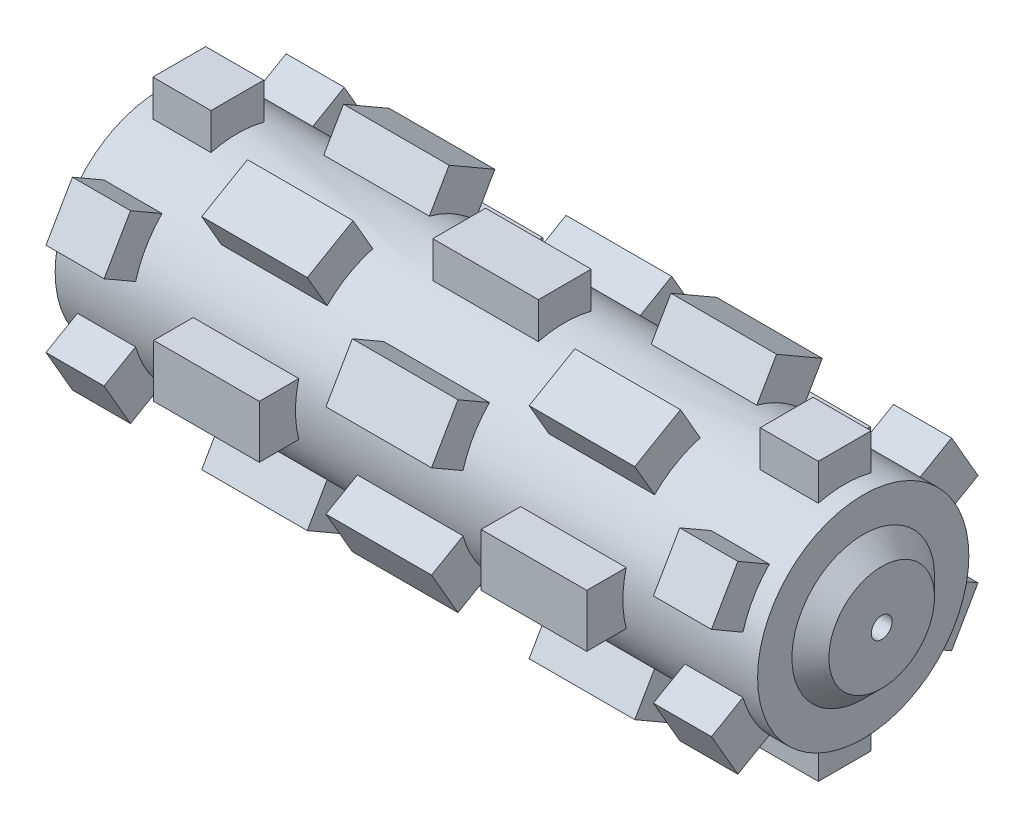
from build123d import *
from build123d.topology import SkipClean

# Parameters (mm, degrees)
SKETCH1_R            = 50.8
SKETCH1_W            = 25.4
SKETCH1_H            = 31.75
BOSS_EXTRUDE3_DEPTH  = 50.8
SKETCH2_R            = 50.8
BOSS_EXTRUDE4_DEPTH  = 27.94
SKETCH3_R            = 50.8
BOSS_EXTRUDE5_DEPTH  = 50.8
SKETCH4_R            = 50.8
BOSS_EXTRUDE6_DEPTH  = 27.94
SKETCH5_R            = 50.8
SKETCH5_W            = 25.4
SKETCH5_H            = 31.75
BOSS_EXTRUDE7_DEPTH  = 27.94
BOSS_EXTRUDE8_START  = 27.94
SKETCH6_R            = 50.8
BOSS_EXTRUDE8_DEPTH  = 27.94
BOSS_EXTRUDE9_START  = 50.8
SKETCH7_R            = 50.8
SKETCH7_W            = 31.75
SKETCH7_H            = 25.4
BOSS_EXTRUDE9_DEPTH  = 50.8
BOSS_EXTRUDE10_START = 27.94
SKETCH8_R            = 50.8
BOSS_EXTRUDE10_DEPTH = 27.94
BOSS_EXTRUDE11_START = 27.94
SKETCH9_R            = 50.8
SKETCH9_W            = 25.4
SKETCH9_H            = 31.75
BOSS_EXTRUDE11_DEPTH = 27.94
SKETCH10_R           = 50.8
BOSS_EXTRUDE12_DEPTH = 8.89
BOSS_EXTRUDE13_START = 8.89
SKETCH11_R           = 50.8
BOSS_EXTRUDE13_DEPTH = 8.89
SKETCH12_R           = 25.4
BOSS_EXTRUDE14_DEPTH = 8.89
BOSS_EXTRUDE15_START = 8.89
SKETCH13_R           = 25.4
BOSS_EXTRUDE15_DEPTH = 8.89
SKETCH14_R           = 5
CUT_EXTRUDE1_DEPTH   = 369.166294367
CHAMFER3_SIZE        = 8.89


with BuildPart() as part:
    # Sketch1 → Boss-Extrude3 (new body)
    with BuildSketch(Plane(origin=(0, 0, 0), x_dir=(0, 0, -1), z_dir=(1, 0, 0))):
        Circle(SKETCH1_R)
        with Locations((0, 50.8)):
            Rectangle(SKETCH1_W, SKETCH1_H)
        Polygon((51.392243797, 44.336022628), (23.895937227, 28.461022628), (36.595937227, 6.463977372), (64.092243797, 22.338977372), align=None)
        Polygon((64.092243797, -22.338977372), (36.595937227, -6.463977372), (23.895937227, -28.461022628), (51.392243797, -44.336022628), align=None)
        with Locations((0, -50.8)):
            Rectangle(SKETCH1_W, SKETCH1_H)
        Polygon((-51.392243797, -44.336022628), (-23.895937227, -28.461022628), (-36.595937227, -6.463977372), (-64.092243797, -22.338977372), align=None)
        Polygon((-64.092243797, 22.338977372), (-36.595937227, 6.463977372), (-23.895937227, 28.461022628), (-51.392243797, 44.336022628), align=None)
    extrude(amount=BOSS_EXTRUDE3_DEPTH)

    # Sketch2 → Boss-Extrude4 (add)
    with BuildSketch(Plane(origin=(50.8, 0, 0), x_dir=(0, 0, -1), z_dir=(1, 0, 0))):
        with Locations(Location((0, 0, 0), (0, 0, 164.477512186))):
            Circle(SKETCH2_R)
    extrude(amount=BOSS_EXTRUDE4_DEPTH)

    # Sketch3 → Boss-Extrude5 (add)
    with BuildSketch(Plane(origin=(78.74, 0, 0), x_dir=(0, 0, -1), z_dir=(1, 0, 0))):
        with Locations(Location((0, 0, 0), (0, 0, 165.522487814))):
            Circle(SKETCH3_R)
        Polygon((36.437276545, 12.7), (36.437276545, 0), (36.437276545, -12.7), (68.187276545, -12.7), (68.187276545, 12.7), align=None)
        Polygon((18.218638272, 31.555607132), (29.2171609, 25.205607132), (45.0921609, 52.701913703), (23.095115644, 65.401913703), (7.220115644, 37.905607132), align=None)
        Polygon((29.2171609, -25.205607132), (18.218638272, -31.555607132), (7.220115644, -37.905607132), (23.095115644, -65.401913703), (45.0921609, -52.701913703), align=None)
        Polygon((-7.220115644, -37.905607132), (-18.218638272, -31.555607132), (-29.2171609, -25.205607132), (-45.0921609, -52.701913703), (-23.095115644, -65.401913703), align=None)
        Polygon((-36.437276545, -12.7), (-36.437276545, 0), (-36.437276545, 12.7), (-68.187276545, 12.7), (-68.187276545, -12.7), align=None)
        Polygon((-29.2171609, 25.205607132), (-18.218638272, 31.555607132), (-7.220115644, 37.905607132), (-23.095115644, 65.401913703), (-45.0921609, 52.701913703), align=None)
    extrude(amount=BOSS_EXTRUDE5_DEPTH)

    # Sketch4 → Boss-Extrude6 (add)
    with BuildSketch(Plane(origin=(129.54, 0, 0), x_dir=(0, 0, -1), z_dir=(1, 0, 0))):
        with Locations(Location((0, 0, 0), (0, 0, 164.477512186))):
            Circle(SKETCH4_R)
    extrude(amount=BOSS_EXTRUDE6_DEPTH)

    # Sketch5 → Boss-Extrude7 (add)
    with BuildSketch(Plane(origin=(157.48, 0, 0), x_dir=(0, 0, -1), z_dir=(1, 0, 0))):
        with Locations(Location((0, 0, 0), (0, 0, 164.477512186))):
            Circle(SKETCH5_R)
        with Locations((0, 50.8)):
            Rectangle(SKETCH5_W, SKETCH5_H)
        Polygon((51.392243797, 44.336022628), (23.895937227, 28.461022628), (36.595937227, 6.463977372), (64.092243797, 22.338977372), align=None)
        Polygon((64.092243797, -22.338977372), (36.595937227, -6.463977372), (23.895937227, -28.461022628), (51.392243797, -44.336022628), align=None)
        with Locations((0, -50.8)):
            Rectangle(SKETCH5_W, SKETCH5_H)
        Polygon((-51.392243797, -44.336022628), (-23.895937227, -28.461022628), (-36.595937227, -6.463977372), (-64.092243797, -22.338977372), align=None)
        Polygon((-64.092243797, 22.338977372), (-36.595937227, 6.463977372), (-23.895937227, 28.461022628), (-51.392243797, 44.336022628), align=None)
    extrude(amount=BOSS_EXTRUDE7_DEPTH)

    # Sketch6 → Boss-Extrude8 (add)
    with SkipClean():  # the faces are left unmerged after this step: merging them gives an invalid solid
        with BuildSketch(Plane.ZY.offset(BOSS_EXTRUDE8_START)):
            Circle(SKETCH6_R)
        extrude(amount=-BOSS_EXTRUDE8_DEPTH)

    # Sketch7 → Boss-Extrude9 (add)
    with SkipClean():  # the faces are left unmerged after this step: merging them gives an invalid solid
        with BuildSketch(Plane.ZY.offset(27.94).offset(BOSS_EXTRUDE9_START)):
            with Locations(Location((0, 0, 0), (0, 0, 345.522487814))):
                Circle(SKETCH7_R)
            Polygon((23.095115644, 65.401913703), (45.0921609, 52.701913703), (29.2171609, 25.205607132), (7.220115644, 37.905607132), align=None)
            with Locations((52.312276545, 0)):
                Rectangle(SKETCH7_W, SKETCH7_H)
            Polygon((29.2171609, -25.205607132), (45.0921609, -52.701913703), (23.095115644, -65.401913703), (7.220115644, -37.905607132), align=None)
            Polygon((-7.220115644, -37.905607132), (-23.095115644, -65.401913703), (-45.0921609, -52.701913703), (-29.2171609, -25.205607132), align=None)
            with Locations((-52.312276545, 0)):
                Rectangle(SKETCH7_W, SKETCH7_H)
            Polygon((-29.2171609, 25.205607132), (-45.0921609, 52.701913703), (-23.095115644, 65.401913703), (-7.220115644, 37.905607132), align=None)
        extrude(amount=-BOSS_EXTRUDE9_DEPTH)

    # Sketch8 → Boss-Extrude10 (add)
    with SkipClean():  # the faces are left unmerged after this step: merging them gives an invalid solid
        with BuildSketch(Plane.ZY.offset(78.74).offset(BOSS_EXTRUDE10_START)):
            Circle(SKETCH8_R)
        extrude(amount=-BOSS_EXTRUDE10_DEPTH)

    # Sketch9 → Boss-Extrude11 (add)
    with SkipClean():  # the faces are left unmerged after this step: merging them gives an invalid solid
        with BuildSketch(Plane.ZY.offset(106.68).offset(BOSS_EXTRUDE11_START)):
            with Locations(Location((0, 0, 0), (0, 0, 15.522487814))):
                Circle(SKETCH9_R)
            with Locations((0, 50.8)):
                Rectangle(SKETCH9_W, SKETCH9_H)
            Polygon((51.392243797, 44.336022628), (23.895937227, 28.461022628), (36.595937227, 6.463977372), (64.092243797, 22.338977372), align=None)
            Polygon((64.092243797, -22.338977372), (36.595937227, -6.463977372), (23.895937227, -28.461022628), (51.392243797, -44.336022628), align=None)
            with Locations((0, -50.8)):
                Rectangle(SKETCH9_W, SKETCH9_H)
            Polygon((-51.392243797, -44.336022628), (-23.895937227, -28.461022628), (-36.595937227, -6.463977372), (-64.092243797, -22.338977372), align=None)
            Polygon((-64.092243797, 22.338977372), (-36.595937227, 6.463977372), (-23.895937227, 28.461022628), (-51.392243797, 44.336022628), align=None)
        extrude(amount=-BOSS_EXTRUDE11_DEPTH)

    # Sketch10 → Boss-Extrude12 (add)
    with SkipClean():  # the faces are left unmerged after this step: merging them gives an invalid solid
        with BuildSketch(Plane(origin=(185.42, 0, 0), x_dir=(0, 0, -1), z_dir=(1, 0, 0))):
            with Locations(Location((0, 0, 0), (0, 0, 195.522487814))):
                Circle(SKETCH10_R)
        extrude(amount=BOSS_EXTRUDE12_DEPTH)

    # Sketch11 → Boss-Extrude13 (add)
    with SkipClean():  # the faces are left unmerged after this step: merging them gives an invalid solid
        with BuildSketch(Plane.ZY.offset(134.62).offset(BOSS_EXTRUDE13_START)):
            Circle(SKETCH11_R)
        extrude(amount=-BOSS_EXTRUDE13_DEPTH)

    # Sketch12 → Boss-Extrude14 (add)
    with SkipClean():  # the faces are left unmerged after this step: merging them gives an invalid solid
        with BuildSketch(Plane(origin=(194.31, 0, 0), x_dir=(0, 0, -1), z_dir=(1, 0, 0))):
            Circle(SKETCH12_R)
        extrude(amount=BOSS_EXTRUDE14_DEPTH)

    # Sketch13 → Boss-Extrude15 (add)
    with SkipClean():  # the faces are left unmerged after this step: merging them gives an invalid solid
        with BuildSketch(Plane.ZY.offset(143.51).offset(BOSS_EXTRUDE15_START)):
            with Locations(Location((0, 0, 0), (0, 0, 180))):
                Circle(SKETCH13_R)
        extrude(amount=-BOSS_EXTRUDE15_DEPTH)

    # Sketch14 → Cut-Extrude1 (cut, through all)
    with SkipClean():  # the faces are left unmerged after this step: merging them gives an invalid solid
        with BuildSketch(Plane.ZY.offset(152.4)):
            Circle(SKETCH14_R)
        extrude(amount=-CUT_EXTRUDE1_DEPTH, mode=Mode.SUBTRACT)

    # Chamfer3
    chamfer3_edges = [part.edges().sort_by_distance(p)[0] for p in [
        (194.31, 0, 25.4),
        (-143.51, 0, 25.4),
    ]]
    chamfer(chamfer3_edges, length=CHAMFER3_SIZE - 0.0001)  # a hair under: the kernel refuses the full size


solid = part.part
